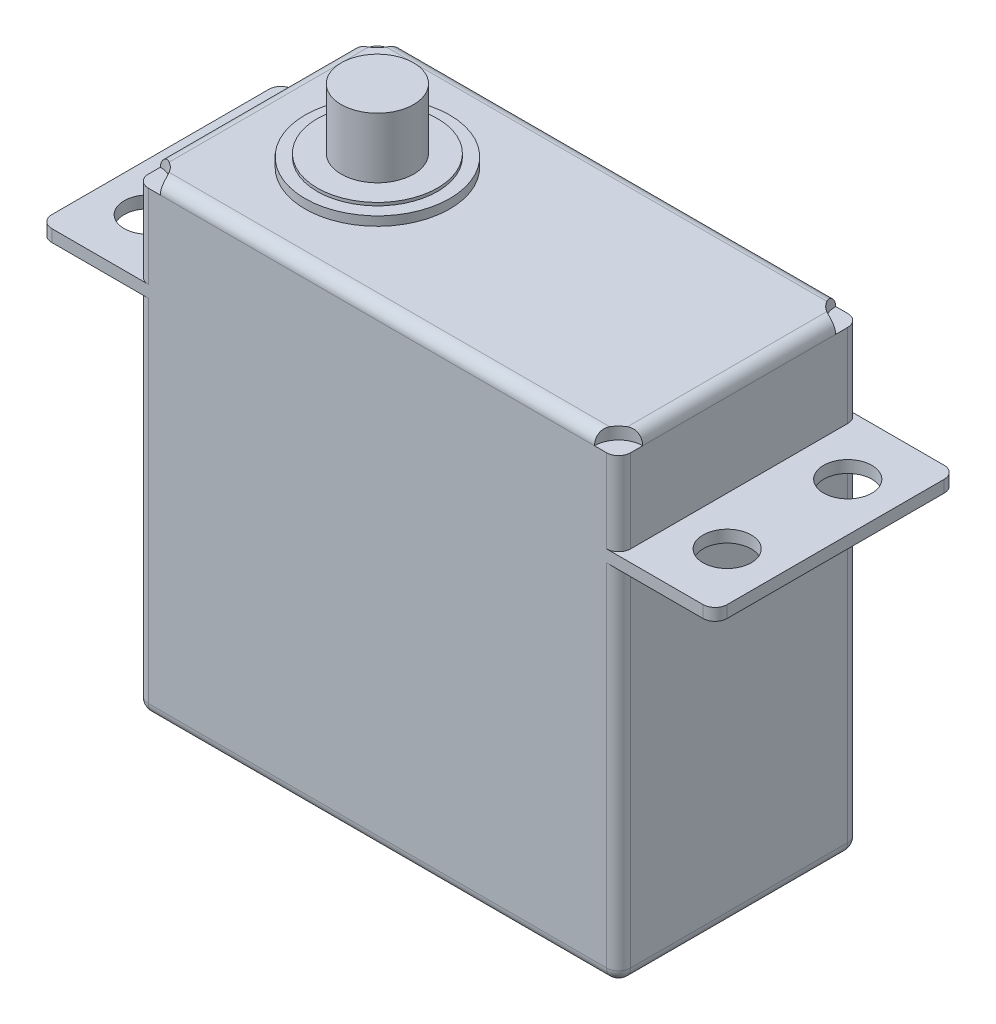
from build123d import *

# Parameters (mm, degrees)
SKETCH_1_W          = 40
SKETCH_1_H          = 10
EXTRUDE_2_DEPTH     = 39
SKETCH_4_W          = 10
SKETCH_4_H          = 1
EXTRUDE_8_DEPTH     = 8
SKETCH_12_W         = 10
SKETCH_12_H         = 1
EXTRUDE_9_DEPTH     = 8
SKETCH_14_W         = 40
SKETCH_14_H         = 20
EXTRUDE_10_DEPTH    = 39
SKETCH_15_W         = 20
SKETCH_15_H         = 1
EXTRUDE_12_DEPTH    = 8
SKETCH_16_W         = 20
SKETCH_16_H         = 1
EXTRUDE_13_DEPTH    = 8
SKETCH_17_R         = 6
EXTRUDE_15_DEPTH    = 0.75
SKETCH_19_R         = 4.98600358
EXTRUDE_16_DEPTH    = 0.25
SKETCH_20_R         = 3
EXTRUDE_17_DEPTH    = 5
SKETCH_22_R         = 2
CUT_EXTRUDE_1_DEPTH = 5
SKETCH_23_R         = 2
CUT_EXTRUDE_3_DEPTH = 5
FILLET_12_R         = 1
FILLET_13_R         = 1
SKETCH_27_R         = 2
CUT_EXTRUDE_4_DEPTH = 1
FILLET_14_R         = 1
FILLET_START        = -9
FILLET_15_DEPTH     = 18
FILLET_START_2      = -19.678632008
FILLET_15_2_DEPTH   = 39.357264016
FILLET_16_R         = 1


with BuildPart() as part:
    # 草图1 → 凸台-拉伸2 (new body)
    with BuildSketch(Plane(origin=(0, 0, 0), x_dir=(1, 0, 0), z_dir=(0, 1, 0))):
        Rectangle(SKETCH_1_W, SKETCH_1_H)
    extrude(amount=EXTRUDE_2_DEPTH)

    # 草图4 → 凸台-拉伸8 (add)
    with BuildSketch(Plane.ZY.offset(20)):
        with Locations((0, 30.596439846)):
            Rectangle(SKETCH_4_W, SKETCH_4_H)
    extrude(amount=EXTRUDE_8_DEPTH)

    # 草图12 → 凸台-拉伸9 (add)
    with BuildSketch(Plane(origin=(20, 0, 0), x_dir=(0, 0, -1), z_dir=(1, 0, 0))):
        with Locations((0, 30.596439846)):
            Rectangle(SKETCH_12_W, SKETCH_12_H)
    extrude(amount=EXTRUDE_9_DEPTH)

    # 草图14 → 凸台-拉伸10 (add)
    with BuildSketch(Plane.XZ):
        Rectangle(SKETCH_14_W, SKETCH_14_H)
    extrude(amount=-EXTRUDE_10_DEPTH)

    # 草图15 → 凸台-拉伸12 (add)
    with BuildSketch(Plane.ZY.offset(20)):
        with Locations((0, 30.596439846)):
            Rectangle(SKETCH_15_W, SKETCH_15_H)
    extrude(amount=EXTRUDE_12_DEPTH)

    # 草图16 → 凸台-拉伸13 (add)
    with BuildSketch(Plane(origin=(20, 0, 0), x_dir=(0, 0, -1), z_dir=(1, 0, 0))):
        with Locations((0, 30.596439846)):
            Rectangle(SKETCH_16_W, SKETCH_16_H)
    extrude(amount=EXTRUDE_13_DEPTH)

    # 草图17 → 凸台-拉伸15 (add)
    with BuildSketch(Plane(origin=(0, 39, 0), x_dir=(1, 0, 0), z_dir=(0, 1, 0))):
        with Locations(Location((-10, 0, 0), (0, 0, 90))):
            Circle(SKETCH_17_R)
    extrude(amount=EXTRUDE_15_DEPTH)

    # 草图19 → 凸台-拉伸16 (add)
    with BuildSketch(Plane(origin=(0, 39.75, 0), x_dir=(1, 0, 0), z_dir=(0, 1, 0))):
        with Locations(Location((-10, 0, 0), (0, 0, 270))):
            Circle(SKETCH_19_R)
    extrude(amount=EXTRUDE_16_DEPTH)

    # 草图20 → 凸台-拉伸17 (add)
    with BuildSketch(Plane(origin=(0, 40, 0), x_dir=(1, 0, 0), z_dir=(0, 1, 0))):
        with Locations(Location((-10, 0, 0), (0, 0, 270))):
            Circle(SKETCH_20_R)
    extrude(amount=EXTRUDE_17_DEPTH)

    # 草图22 → 切除-拉伸1 (cut)
    with BuildSketch(Plane(origin=(0, 31.096439846, 0), x_dir=(1, 0, 0), z_dir=(0, 1, 0))):
        with Locations(Location((-24, 5, 0), (0, 0, 270))):
            Circle(SKETCH_22_R)
        with Locations(Location((-24, -5, 0), (0, 0, 270))):
            Circle(SKETCH_22_R)
    extrude(amount=-CUT_EXTRUDE_1_DEPTH, mode=Mode.SUBTRACT)

    # 草图23 → 切除-拉伸3 (cut)
    with BuildSketch(Plane(origin=(0, 31.096439846, 0), x_dir=(1, 0, 0), z_dir=(0, 1, 0))):
        with Locations(Location((24, 5, 0), (0, 0, 270))):
            Circle(SKETCH_23_R)
        with Locations(Location((24, -5, 0), (0, 0, 270))):
            Circle(SKETCH_23_R)
    extrude(amount=-CUT_EXTRUDE_3_DEPTH, mode=Mode.SUBTRACT)

    # 圆角12
    fillet_12_edges = [part.edges().sort_by_distance(p)[0] for p in [
        (0, 0, -10),
        (0, 0, 10),
        (-20, 0, 0),
        (20, 0, 0),
    ]]
    fillet(fillet_12_edges, radius=FILLET_12_R)

    # 圆角13
    # the kernel refuses this fillet: 1 mm, written as the material it takes off along each edge
    with BuildSketch(Plane(origin=(19, 1, -9), x_dir=(1, 0, 0), z_dir=(0, 0, -1))) as fillet_13_piece_1_section:
        Polygon((0, 0), (FILLET_13_R * 1.02, 0), (FILLET_13_R * 1.02, FILLET_13_R * 1.02), (0, FILLET_13_R * 1.02), align=None)
    fillet_13_piece_1 = extrude(amount=FILLET_13_R * 1.02, mode=Mode.PRIVATE)
    fillet_13_piece_1 = fillet_13_piece_1 - Plane(origin=(19, 1, -9), x_dir=(-0.7071067811865475, 0.7071067811865475, 0), z_dir=(0, 0, -1)) * Sphere(FILLET_13_R, mode=Mode.PRIVATE)
    add(fillet_13_piece_1, mode=Mode.SUBTRACT)
    with BuildSketch(Plane(origin=(19, 1, 9), x_dir=(0, 0, 1), z_dir=(1, 0, 0))) as fillet_13_piece_2_section:
        Polygon((0, 0), (FILLET_13_R * 1.02, 0), (FILLET_13_R * 1.02, FILLET_13_R * 1.02), (0, FILLET_13_R * 1.02), align=None)
    fillet_13_piece_2 = extrude(amount=FILLET_13_R * 1.02, mode=Mode.PRIVATE)
    fillet_13_piece_2 = fillet_13_piece_2 - Plane(origin=(19, 1, 9), x_dir=(0, 0.7071067811865475, -0.7071067811865475), z_dir=(1, 0, 0)) * Sphere(FILLET_13_R, mode=Mode.PRIVATE)
    add(fillet_13_piece_2, mode=Mode.SUBTRACT)
    with BuildSketch(Plane(origin=(-19, 1, -9), x_dir=(-1, 0, 0), z_dir=(0, 0, -1))) as fillet_13_piece_3_section:
        Polygon((0, 0), (FILLET_13_R * 1.02, 0), (FILLET_13_R * 1.02, -FILLET_13_R * 1.02), (0, -FILLET_13_R * 1.02), align=None)
    fillet_13_piece_3 = extrude(amount=FILLET_13_R * 1.02, mode=Mode.PRIVATE)
    fillet_13_piece_3 = fillet_13_piece_3 - Plane(origin=(-19, 1, -9), x_dir=(0.7071067811865475, 0.7071067811865475, 0), z_dir=(0, 0, -1)) * Sphere(FILLET_13_R, mode=Mode.PRIVATE)
    add(fillet_13_piece_3, mode=Mode.SUBTRACT)
    with BuildSketch(Plane(origin=(-19, 1, 9), x_dir=(0, 0, 1), z_dir=(-1, 0, 0))) as fillet_13_piece_4_section:
        Polygon((0, 0), (FILLET_13_R * 1.02, 0), (FILLET_13_R * 1.02, -FILLET_13_R * 1.02), (0, -FILLET_13_R * 1.02), align=None)
    fillet_13_piece_4 = extrude(amount=FILLET_13_R * 1.02, mode=Mode.PRIVATE)
    fillet_13_piece_4 = fillet_13_piece_4 - Plane(origin=(-19, 1, 9), x_dir=(0, 0.7071067811865475, -0.7071067811865475), z_dir=(-1, 0, 0)) * Sphere(FILLET_13_R, mode=Mode.PRIVATE)
    add(fillet_13_piece_4, mode=Mode.SUBTRACT)
    with BuildSketch(Plane(origin=(-20, 1, -10), x_dir=(1, 0, 0), z_dir=(0, 1, 0)), Plane(origin=(-20, 1, 10), x_dir=(0, 0, -1), z_dir=(0, 1, 0))) as fillet_13_piece_5:
        with BuildLine():
            CenterArc((FILLET_13_R, -FILLET_13_R), FILLET_13_R, 90, 90)
            Line((0, -FILLET_13_R), (0, 0))
            Line((0, 0), (FILLET_13_R, 0))
        make_face()
    extrude(amount=29.096439846, mode=Mode.SUBTRACT)
    with BuildSketch(Plane(origin=(20, 1, -10), x_dir=(-1, 0, 0), z_dir=(0, 1, 0)), Plane(origin=(20, 1, 10), x_dir=(0, 0, -1), z_dir=(0, 1, 0))) as fillet_13_piece_6:
        with BuildLine():
            CenterArc((FILLET_13_R, FILLET_13_R), FILLET_13_R, 180, 90)
            Line((0, FILLET_13_R), (0, 0))
            Line((0, 0), (FILLET_13_R, 0))
        make_face()
    extrude(amount=29.096439846, mode=Mode.SUBTRACT)

    # 草图27 → 切除-拉伸4 (cut)
    with BuildSketch(Plane(origin=(0, 39, 0), x_dir=(1, 0, 0), z_dir=(0, 1, 0))):
        with Locations((-20, 10)):
            Circle(SKETCH_27_R)
        with Locations((20, 10)):
            Circle(SKETCH_27_R)
        with Locations((20, -10)):
            Circle(SKETCH_27_R)
        with Locations((-20, -10)):
            Circle(SKETCH_27_R)
    extrude(amount=-CUT_EXTRUDE_4_DEPTH, mode=Mode.SUBTRACT)

    # 圆角14
    fillet_14_edges = [part.edges().sort_by_distance(p)[0] for p in [
        (-20, 34.548219923, -10),
        (20, 34.548219923, -10),
        (20, 34.548219923, 10),
        (-20, 34.548219923, 10),
    ]]
    fillet(fillet_14_edges, radius=FILLET_14_R)

    # 圆角15: read off the stored shape, not the designer's step
    # 圆角15 outline → 圆角15 (cut)
    with BuildSketch(Plane.XY.offset(FILLET_START)):
        with BuildLine():
            Line((20, 39), (19, 39))
            ThreePointArc((19, 39), (19.707106781, 38.707106781), (20, 38))
            Line((20, 38), (20, 39))
        make_face()
        with BuildLine():
            ThreePointArc((-20, 38), (-19.707106781, 38.707106781), (-19, 39))
            Line((-19, 39), (-20, 39))
            Line((-20, 39), (-20, 38))
        make_face()
    extrude(amount=FILLET_15_DEPTH, mode=Mode.SUBTRACT)

    # Fillet 15 2 outline → Fillet 15 2 (cut)
    with BuildSketch(Plane.YZ.offset(FILLET_START_2)):
        with BuildLine():
            Line((39, -10), (39, -9))
            ThreePointArc((39, -9), (38.707106781, -9.707106781), (38, -10))
            Line((38, -10), (39, -10))
        make_face()
        with BuildLine():
            ThreePointArc((38, 10), (38.707106781, 9.707106781), (39, 9))
            Line((39, 9), (39, 10))
            Line((39, 10), (38, 10))
        make_face()
    extrude(amount=FILLET_15_2_DEPTH, mode=Mode.SUBTRACT)

    # 圆角16
    fillet_16_edges = [part.edges().sort_by_distance(p)[0] for p in [
        (28, 30.596439846, -10),
        (28, 30.596439846, 10),
        (-28, 30.596439846, -10),
        (-28, 30.596439846, 10),
    ]]
    fillet(fillet_16_edges, radius=FILLET_16_R)


solid = part.part
